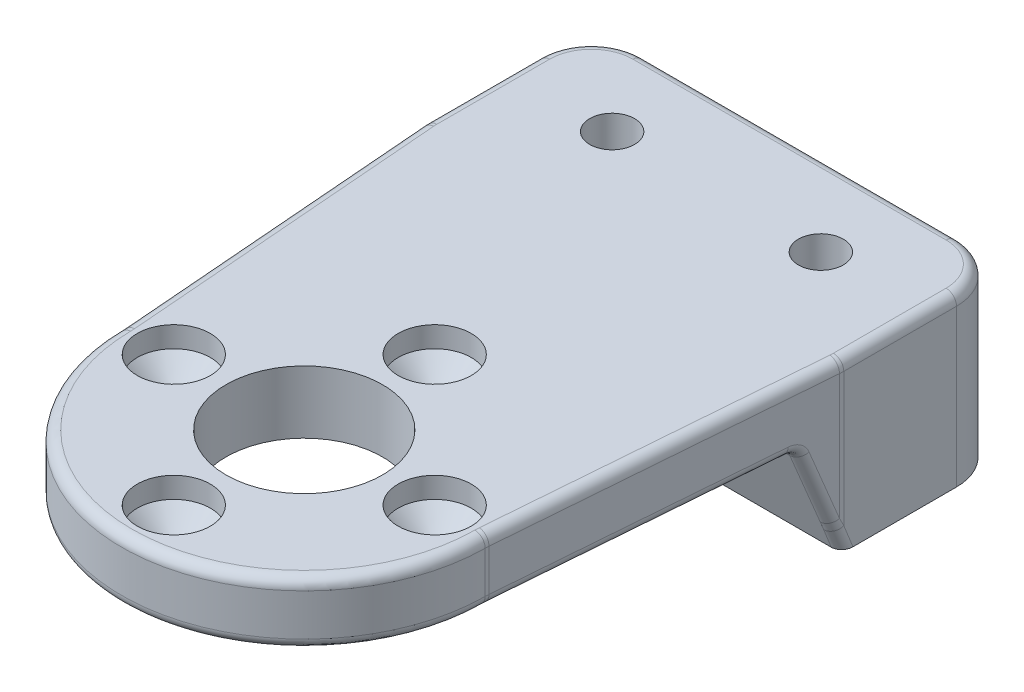
from build123d import *

# Parameters (mm, degrees)
SKETCH1_R           = 17.5
SKETCH1_R_2         = 1.6
SKETCH1_R_3         = 7.5
BOSS_EXTRUDE1_DEPTH = 4
SKETCH2_R           = 17.5
SKETCH2_R_2         = 3.5
SKETCH2_R_3         = 7.5
BOSS_EXTRUDE2_DEPTH = 2
BOSS_EXTRUDE3_START = -6
BOSS_EXTRUDE3_DEPTH = 6
SKETCH4_W           = 40
SKETCH4_H           = 16
BOSS_EXTRUDE4_DEPTH = 10
CHAMFER3_SIZE2      = 4
CHAMFER3_SIZE       = 10
FILLET2_R           = 5
FILLET3_R           = 1
FILLET4_R           = 1
SKETCH5_R           = 2.15
CUT_EXTRUDE1_DEPTH  = 54.965266674
CUT_EXTRUDE2_START  = -5.5
CUT_EXTRUDE2_DEPTH  = 4
CHAMFER4_SIZE       = 1.9


# Some blends are built 0.0001 mm under size
with BuildPart() as part:
    # Sketch1 → Boss-Extrude1 (new body)
    with BuildSketch(Plane(origin=(0, 0, 0), x_dir=(1, 0, 0), z_dir=(0, 1, 0))):
        with Locations(Location((0, 0, 0), (0, 0, 270))):
            Circle(SKETCH1_R)
        with Locations(Location((-12.5, 0, 0), (0, 0, 270))):
            Circle(SKETCH1_R_2, mode=Mode.SUBTRACT)
        with Locations(Location((0, 12.5, 0), (0, 0, 270))):
            Circle(SKETCH1_R_2, mode=Mode.SUBTRACT)
        with Locations(Location((12.5, 0, 0), (0, 0, 270))):
            Circle(SKETCH1_R_2, mode=Mode.SUBTRACT)
        with Locations(Location((0, -12.5, 0), (0, 0, 270))):
            Circle(SKETCH1_R_2, mode=Mode.SUBTRACT)
        with Locations(Location((0, 0, 0), (0, 0, 270))):
            Circle(SKETCH1_R_3, mode=Mode.SUBTRACT)
    extrude(amount=BOSS_EXTRUDE1_DEPTH)

    # Sketch2 → Boss-Extrude2 (add)
    with BuildSketch(Plane(origin=(0, 4, 0), x_dir=(1, 0, 0), z_dir=(0, 1, 0))):
        with Locations(Location((0, 0, 0), (0, 0, 270))):
            Circle(SKETCH2_R)
        with Locations(Location((0, -12.5, 0), (0, 0, 270))):
            Circle(SKETCH2_R_2, mode=Mode.SUBTRACT)
        with Locations(Location((12.5, 0, 0), (0, 0, 270))):
            Circle(SKETCH2_R_2, mode=Mode.SUBTRACT)
        with Locations(Location((0, 12.5, 0), (0, 0, 270))):
            Circle(SKETCH2_R_2, mode=Mode.SUBTRACT)
        with Locations(Location((-12.5, 0, 0), (0, 0, 270))):
            Circle(SKETCH2_R_2, mode=Mode.SUBTRACT)
        with Locations(Location((0, 0, 0), (0, 0, 270))):
            Circle(SKETCH2_R_3, mode=Mode.SUBTRACT)
    extrude(amount=BOSS_EXTRUDE2_DEPTH)

    # Sketch3 → Boss-Extrude3 (add)
    with BuildSketch(Plane(origin=(0, 6, 0), x_dir=(1, 0, 0), z_dir=(0, 1, 0)).offset(BOSS_EXTRUDE3_START)):
        with BuildLine():
            Line((-20, 31.5), (-17.5, 0))
            ThreePointArc((-17.5, 0), (0, 17.5), (17.5, 0))
            Line((17.5, 0), (20, 31.5))
            Line((20, 31.5), (20, 47.5))
            Line((20, 47.5), (-20, 47.5))
            Line((-20, 47.5), (-20, 31.5))
        make_face()
    extrude(amount=BOSS_EXTRUDE3_DEPTH)

    # Sketch4 → Boss-Extrude4 (add)
    with BuildSketch(Plane.XZ):
        with Locations((0, -39.5)):
            Rectangle(SKETCH4_W, SKETCH4_H)
    extrude(amount=BOSS_EXTRUDE4_DEPTH)

    # Chamfer3
    chamfer3_edges = [part.edges().sort_by_distance(p)[0] for p in [
        (0, 0, -31.5),
    ]]
    chamfer3_side = [part.faces().sort_by_distance(p)[0] for p in [
        (0, -0.08, -31.5),
    ]]
    chamfer(chamfer3_edges, length=CHAMFER3_SIZE - 0.0001, length2=CHAMFER3_SIZE2 - 0.0001, reference=chamfer3_side[0])  # a hair under: the kernel refuses the full size

    # Fillet2
    # the kernel refuses this fillet: 5 mm, written as the material it adds along each edge
    with BuildSketch(Plane(origin=(17.5, 0, 0), x_dir=(-0.004678040044384729, 0, 0.9999890579108069), z_dir=(0, 1, 0))) as fillet2_piece_1:
        with BuildLine():
            CenterArc((0.187121602, 4.99994529), FILLET2_R, 265.730260421, 4.001706651)
            Line((-0.185138694, 0.01382232), (-0.1925839, -0.08590014))
            Line((-0.1925839, -0.08590014), (-0.007445206, -0.099722459))
            Line((-0.007445206, -0.099722459), (0.000467804, -0.099998906))
            ThreePointArc((0.000467804, -0.099998906), (0.081865701, -0.099808513), (0.163263598, -0.099998906))
            Line((0.163263598, -0.099998906), (0.163731402, 0))
        make_face()
    extrude(amount=6)
    with BuildSketch(Plane(origin=(-17.5, 0, 0), x_dir=(-0.07911630099811762, 0, -0.9968653925763374), z_dir=(0, 1, 0))) as fillet2_piece_2:
        with BuildLine():
            CenterArc((0.185653959, 5), FILLET2_R, 265.998293349, 4.001706651)
            Line((-0.16327698, 0.01219014), (-0.170255599, -0.087566057))
            ThreePointArc((-0.170255599, -0.087566057), (-0.08906944, -0.093436434), (-0.00791163, -0.099686539))
            Line((-0.00791163, -0.099686539), (0, -0.1))
            Line((0, -0.1), (0.185653959, -0.1))
            Line((0.185653959, -0.1), (0.185653959, 0))
        make_face()
    extrude(amount=6)
    # the kernel refuses this fillet: 5 mm, written as the material it takes off along each edge
    with BuildSketch(Plane(origin=(20, -9.9999, -31.5), x_dir=(-0.07911630099812454, 0, 0.9968653925763369), z_dir=(0, 1, 0)), Plane(origin=(-20, 6, -31.5), x_dir=(0.07911630099812313, 0, 0.996865392576337), z_dir=(0, -1, 0))) as fillet2_2_piece_1:
        with BuildLine():
            CenterArc((FILLET2_R * 0.03962024746, -FILLET2_R), FILLET2_R, 90, 4.537772508)
            Line((-FILLET2_R * 0.0394960535382, -FILLET2_R * 0.00313460742366), (-FILLET2_R * 0.0410783795581, FILLET2_R * 0.0168027004279))
            Line((-FILLET2_R * 0.0410783795581, FILLET2_R * 0.0168027004279), (-FILLET2_R * 0.000792404949199, FILLET2_R * 0.02))
            Line((-FILLET2_R * 0.000792404949199, FILLET2_R * 0.02), (FILLET2_R * 0.03962024746, FILLET2_R * 0.02))
            Line((FILLET2_R * 0.03962024746, FILLET2_R * 0.02), (FILLET2_R * 0.03962024746, 0))
        make_face()
    extrude(amount=15.9999, mode=Mode.SUBTRACT)
    with BuildSketch(Plane(origin=(-20, -10, -47.5), x_dir=(0, 0, 1), z_dir=(0, 1, 0)), Plane(origin=(20, -10, -47.5), x_dir=(-1, 0, 0), z_dir=(0, 1, 0))) as fillet2_2_piece_2:
        with BuildLine():
            CenterArc((FILLET2_R, FILLET2_R), FILLET2_R, 180, 90)
            Line((0, FILLET2_R), (-FILLET2_R * 0.02, FILLET2_R))
            Line((-FILLET2_R * 0.02, FILLET2_R), (-FILLET2_R * 0.02, -FILLET2_R * 0.02))
            Line((-FILLET2_R * 0.02, -FILLET2_R * 0.02), (FILLET2_R, -FILLET2_R * 0.02))
            Line((FILLET2_R, -FILLET2_R * 0.02), (FILLET2_R, 0))
        make_face()
    extrude(amount=16, mode=Mode.SUBTRACT)
    with BuildSketch(Plane(origin=(-20, -9.9999, -31.5), x_dir=(0, 0, -1), z_dir=(0, -1, 0))) as fillet2_2_piece_3:
        with BuildLine():
            CenterArc((FILLET2_R, FILLET2_R), FILLET2_R, 180, 90)
            Line((0, FILLET2_R), (-FILLET2_R * 0.02, FILLET2_R))
            Line((-FILLET2_R * 0.02, FILLET2_R), (-FILLET2_R * 0.02, -FILLET2_R * 0.02))
            Line((-FILLET2_R * 0.02, -FILLET2_R * 0.02), (FILLET2_R, -FILLET2_R * 0.02))
            Line((FILLET2_R, -FILLET2_R * 0.02), (FILLET2_R, 0))
        make_face()
    extrude(amount=0.0001, mode=Mode.SUBTRACT)
    with BuildSketch(Plane(origin=(20, -9.9999, -31.5), x_dir=(0, 0, -1), z_dir=(0, -1, 0))) as fillet2_2_piece_4:
        with BuildLine():
            CenterArc((FILLET2_R, -FILLET2_R), FILLET2_R, 90, 90)
            Line((0, -FILLET2_R), (-FILLET2_R * 0.02, -FILLET2_R))
            Line((-FILLET2_R * 0.02, -FILLET2_R), (-FILLET2_R * 0.02, FILLET2_R * 0.02))
            Line((-FILLET2_R * 0.02, FILLET2_R * 0.02), (FILLET2_R, FILLET2_R * 0.02))
            Line((FILLET2_R, FILLET2_R * 0.02), (FILLET2_R, 0))
        make_face()
    extrude(amount=0.0001, mode=Mode.SUBTRACT)

    # Fillet3
    fillet3_edges = [part.edges().sort_by_distance(p)[0] for p in [
        (0, 0, -27.5001),
    ]]
    fillet(fillet3_edges, radius=FILLET3_R)

    # Fillet4
    fillet4_edges = [part.edges().sort_by_distance(p)[0] for p in [
        (19.673278984, -0.171677734, -27.383315195),
        (19.843415143, -5.067403026, -29.527030806),
        (-19.843415143, -5.067403026, -29.527030806),
        (-19.673278984, -0.171677734, -27.383315195),
        (-18.5717514, 0, -13.504067637),
        (-17.50391568, 0, -0.010806133),
        (0, 0, 17.5),
        (17.50391568, 0, -0.010806133),
        (17.50391568, 6, -0.010806133),
        (0, 6, 17.5),
        (-17.50391568, 6, -0.010806133),
        (-18.749507609, 6, -15.743795869),
        (-19.996080204, 6, -31.500155303),
        (-20, 6, -37.099050619),
        (-18.535533906, 6, -46.035533906),
        (0, 6, -47.5),
        (18.535533906, 6, -46.035533906),
        (20, 6, -37.099050619),
        (19.996080204, 6, -31.500155303),
        (18.5717514, 0, -13.504067637),
        (18.749507609, 6, -15.743795869),
        (19.991180264, -9.753025864, -31.401251827),
        (-19.991180264, -9.753025864, -31.401251827),
    ]]
    fillet(fillet4_edges, radius=FILLET4_R)

    # Sketch5 → Cut-Extrude1 (cut, through all)
    with BuildSketch(Plane.XZ.offset(10)):
        with Locations(Location((-10, -39.5, 0), (0, 0, 270))):
            Circle(SKETCH5_R)
        with Locations(Location((10, -39.5, 0), (0, 0, 270))):
            Circle(SKETCH5_R)
    extrude(amount=-CUT_EXTRUDE1_DEPTH, mode=Mode.SUBTRACT)

    # Sketch6 → Cut-Extrude2 (cut)
    with BuildSketch(Plane.XZ.offset(10).offset(CUT_EXTRUDE2_START)):
        Polygon((-13.6, -45.92166605), (-13.6, -47.5), (-6.4, -47.5), (-6.4, -45.748460969), (-6.4, -37.421539031), (-10, -35.343078062), (-13.6, -37.421539031), align=None)
        Polygon((10, -35.343078062), (6.4, -37.421539031), (6.4, -45.556192203), (6.4, -47.5), (13.6, -47.5), (13.6, -46.076241883), (13.6, -37.421539031), align=None)
    extrude(amount=-CUT_EXTRUDE2_DEPTH, mode=Mode.SUBTRACT)

    # Chamfer4
    chamfer4_edges = [part.edges().sort_by_distance(p)[0] for p in [
        (-12.5, 4, -1.6),
        (0, 4, -14.1),
        (12.5, 4, -1.6),
        (0, 4, 10.9),
    ]]
    chamfer(chamfer4_edges, length=CHAMFER4_SIZE - 0.0001)  # a hair under: the kernel refuses the full size


solid = part.part
